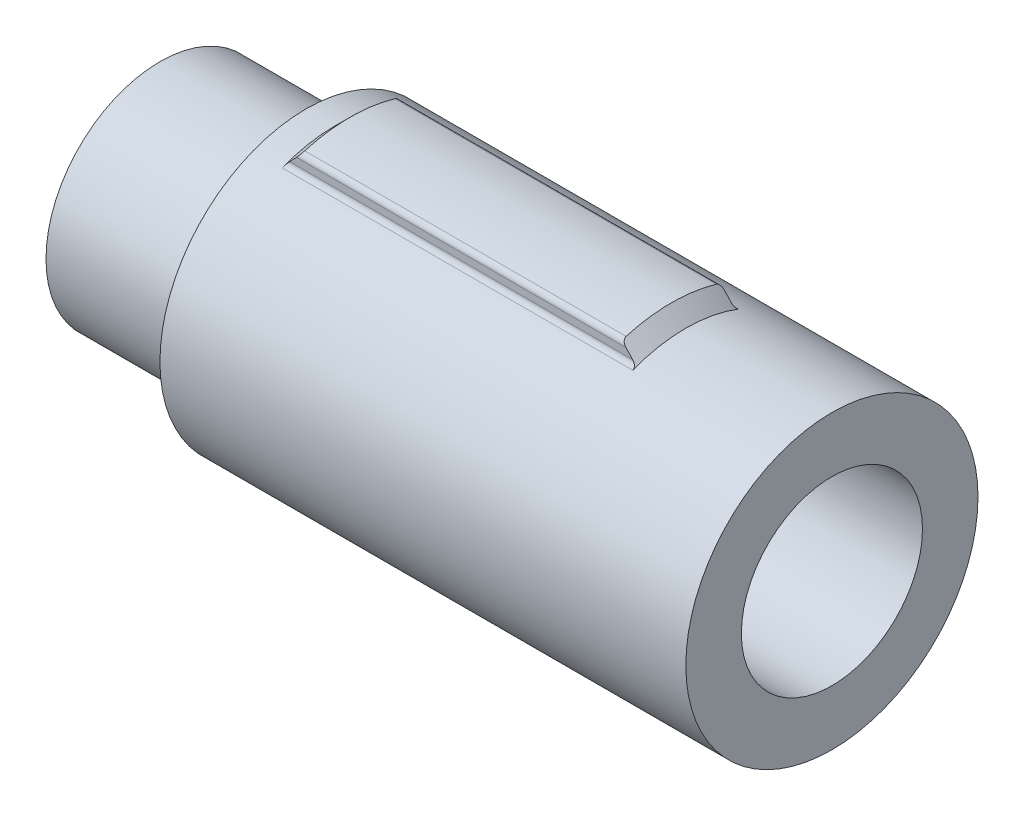
from build123d import *

# Parameters (mm, degrees)
SKETCH_1_R          = 5
EXTRUDE_1_DEPTH     = 18
SKETCH_3_R          = 3.1
CUT_EXTRUDE_1_DEPTH = 17
EXTRUDE_2_DEPTH     = 12
SKETCH_8_R          = 3.9
EXTRUDE_4_DEPTH     = 5
SKETCH_9_R          = 2.6
CUT_EXTRUDE_2_DEPTH = 5
EXTRUDE_5_DEPTH     = 3
FILLET_1_R          = 0.2
CHAMFER_1_SIZE      = 0.5


with BuildPart() as part:
    # 草图1 → 凸台-拉伸1 (new body)
    with BuildSketch(Plane(origin=(0, 0, 0), x_dir=(0, 0, -1), z_dir=(1, 0, 0))):
        Circle(SKETCH_1_R)
    extrude(amount=EXTRUDE_1_DEPTH)

    # 草图3 → 切除-拉伸1 (cut)
    with BuildSketch(Plane(origin=(18, 0, 0), x_dir=(0, 0, -1), z_dir=(1, 0, 0))):
        Circle(SKETCH_3_R)
    extrude(amount=-CUT_EXTRUDE_1_DEPTH, mode=Mode.SUBTRACT)

    # 草图5 → 凸台-拉伸2 (add)
    with BuildSketch(Plane(origin=(1, 0, 0), x_dir=(0, 0, -1), z_dir=(1, 0, 0))):
        with BuildLine():
            Line((-1.688194302, 2.6), (1.688194302, 2.6))
            Line((1.688194302, 2.6), (1.688194302, 5.234500931))
            ThreePointArc((1.688194302, 5.234500931), (0, 5.5), (-1.688194302, 5.234500931))
            Line((-1.688194302, 5.234500931), (-1.688194302, 2.6))
        make_face()
    extrude(amount=EXTRUDE_2_DEPTH)

    # 草图8 → 凸台-拉伸4 (add)
    with BuildSketch(Plane.ZY):
        Circle(SKETCH_8_R)
    extrude(amount=EXTRUDE_4_DEPTH)

    # 草图9 → 切除-拉伸2 (cut)
    with BuildSketch(Plane.ZY.offset(5)):
        Circle(SKETCH_9_R)
    extrude(amount=-CUT_EXTRUDE_2_DEPTH, mode=Mode.SUBTRACT)

    # 草图10 → 凸台-拉伸5 (add)
    with BuildSketch(Plane.ZY):
        Polygon((0.66395281, 1.15), (-0.66395281, 1.15), (-1.327905619, 0), (-0.66395281, -1.15), (0.66395281, -1.15), (1.327905619, 0), align=None)
    extrude(amount=EXTRUDE_5_DEPTH)

    # 圆角1
    fillet_1_edges = [part.edges().sort_by_distance(p)[0] for p in [
        (7, 4.70637865, 1.688194302),
        (7, 5.234500931, 1.688194302),
        (7, 4.70637865, -1.688194302),
        (7, 5.234500931, -1.688194302),
    ]]
    fillet(fillet_1_edges, radius=FILLET_1_R)

    # 倒角1
    # the kernel refuses this chamfer: 0.5 mm, written as the material it takes off along each edge
    with BuildSketch(Plane(origin=(13, 0, 0), x_dir=(0, 0.8686030413593419, -0.4955085837211114), z_dir=(0, -0.4955085837211114, -0.8686030413593419))) as chamfer_1_piece_1:
        Polygon((5.5, -CHAMFER_1_SIZE), (5.5 - CHAMFER_1_SIZE, 0), (5.5, 0), align=None)
    revolve(axis=Axis((13, 0, 0), (1, 0, 0)), revolution_arc=59.40658503, mode=Mode.SUBTRACT)
    with BuildSketch(Plane(origin=(1, 0, 0), x_dir=(0, 0.8686030413593416, -0.4955085837211117), z_dir=(0, -0.4955085837211117, -0.8686030413593416))) as chamfer_1_piece_2:
        Polygon((5.5 - CHAMFER_1_SIZE, 0), (5.5, CHAMFER_1_SIZE), (5.5, 0), align=None)
    revolve(axis=Axis((1, 0, 0), (1, 0, 0)), revolution_arc=59.40658503, mode=Mode.SUBTRACT)
    with BuildSketch(Plane(origin=(13, 2.6, 2.974035796), x_dir=(0.027495876610585623, 0.9996219169112968, 0), z_dir=(0, 0, -1))) as chamfer_1_piece_3_section:
        Polygon((CHAMFER_1_SIZE * 0.999621916911, -CHAMFER_1_SIZE * 0.0274958766106), (-CHAMFER_1_SIZE * 0.0274958766106, -CHAMFER_1_SIZE * 0.999621916911), (0, 0), align=None)
    chamfer_1_piece_3 = extrude(amount=5.948071591, mode=Mode.PRIVATE)
    chamfer_1_piece_3 = chamfer_1_piece_3 & Plane(origin=(12.821912141, 0, 0), x_dir=(0, 0, -1), z_dir=(1, 0, 0)) * Cylinder(3.1, 14, mode=Mode.PRIVATE)
    add(chamfer_1_piece_3, mode=Mode.SUBTRACT)


solid = part.part
